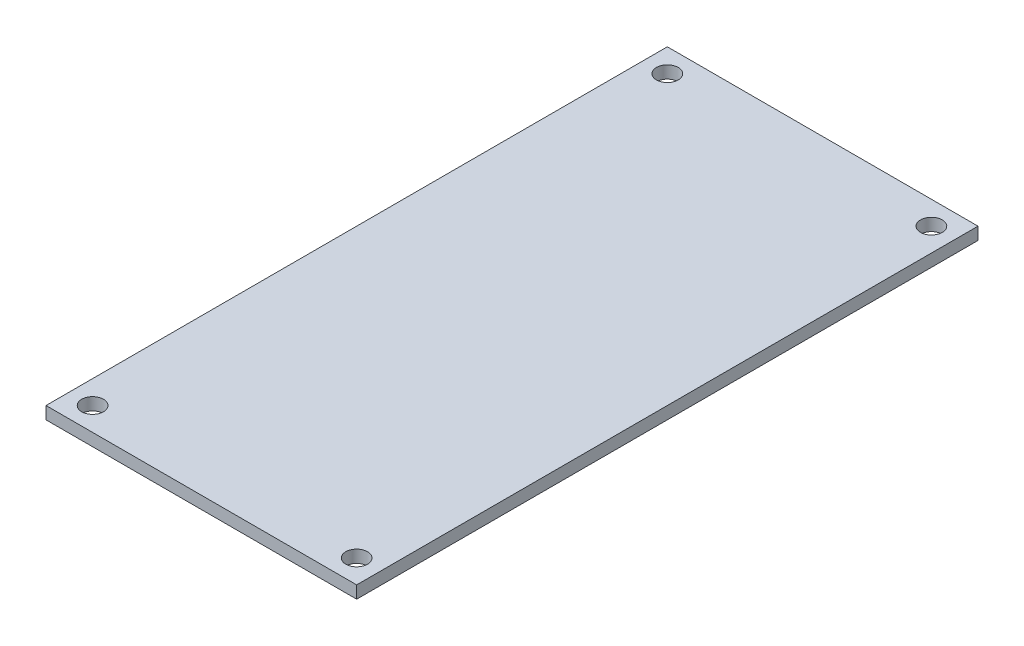
from build123d import *

# Parameters (mm, degrees)
SKETCH_1_W      = 50
SKETCH_1_H      = 100
SKETCH_1_R      = 1.75
EXTRUDE_1_DEPTH = 2


with BuildPart() as part:
    # 스케치1 → 보스-돌출1 (new body)
    with BuildSketch(Plane(origin=(0, 0, 0), x_dir=(1, 0, 0), z_dir=(0, 1, 0))):
        Rectangle(SKETCH_1_W, SKETCH_1_H)
        with Locations((-21.25, 46.25)):
            Circle(SKETCH_1_R, mode=Mode.SUBTRACT)
        with Locations((21.25, 46.25)):
            Circle(SKETCH_1_R, mode=Mode.SUBTRACT)
        with Locations((21.25, -46.25)):
            Circle(SKETCH_1_R, mode=Mode.SUBTRACT)
        with Locations((-21.25, -46.25)):
            Circle(SKETCH_1_R, mode=Mode.SUBTRACT)
    extrude(amount=EXTRUDE_1_DEPTH)


solid = part.part
